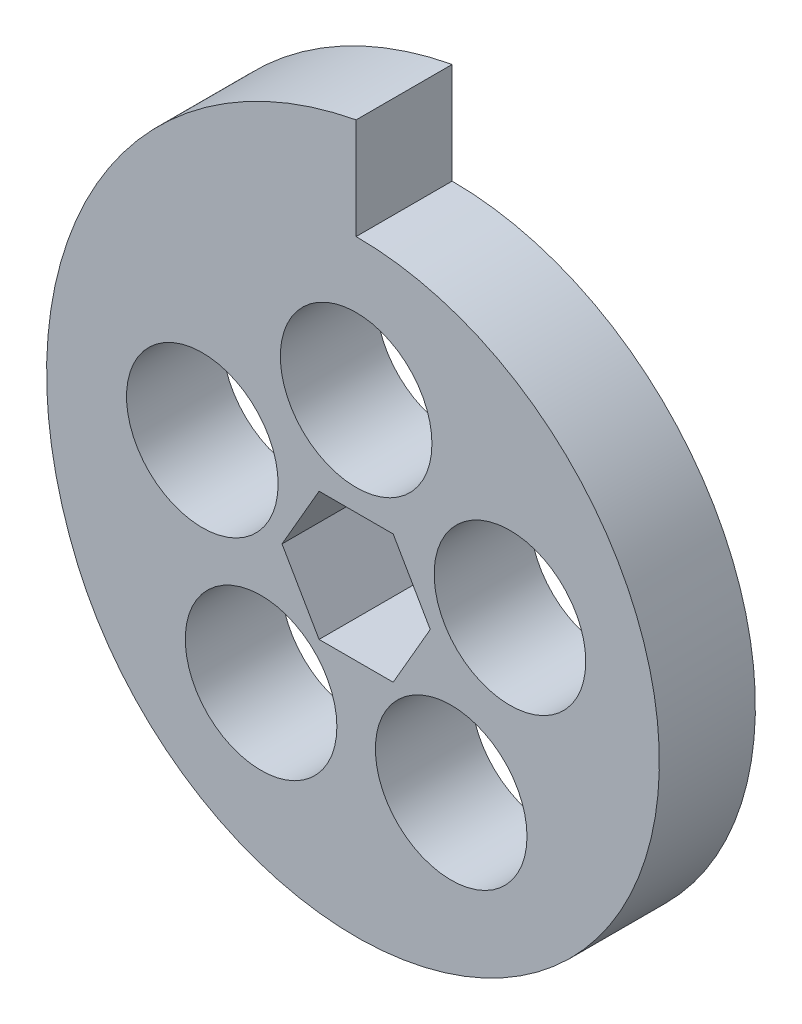
from build123d import *

# Parameters (mm, degrees)
SKETCH3_R           = 7.5
BOSS_EXTRUDE1_DEPTH = 9.5


with BuildPart() as part:
    # Sketch3 → Boss-Extrude1 (new body)
    with BuildSketch(Plane.XY):
        with BuildLine():
            Line((0, 30), (0, 40))
            ThreePointArc((0, 40), (-26.226618707, 20.675980746), (-27.550099413, -11.874006163))
            ThreePointArc((-27.550099413, -11.874006163), (25.062124659, -16.489084497), (0, 30))
        make_face()
        with Locations((0, 16)):
            Circle(SKETCH3_R, mode=Mode.SUBTRACT)
        with Locations((15.216904261, 4.94427191)):
            Circle(SKETCH3_R, mode=Mode.SUBTRACT)
        with Locations((9.404564037, -12.94427191)):
            Circle(SKETCH3_R, mode=Mode.SUBTRACT)
        with Locations((-9.404564037, -12.94427191)):
            Circle(SKETCH3_R, mode=Mode.SUBTRACT)
        with Locations((-15.216904261, 4.94427191)):
            Circle(SKETCH3_R, mode=Mode.SUBTRACT)
        Polygon((7.332348419, 0), (3.666174209, 6.35), (-3.666174209, 6.35), (-7.332348419, 0), (-3.666174209, -6.35), (3.666174209, -6.35), align=None, mode=Mode.SUBTRACT)
    extrude(amount=BOSS_EXTRUDE1_DEPTH)


solid = part.part
